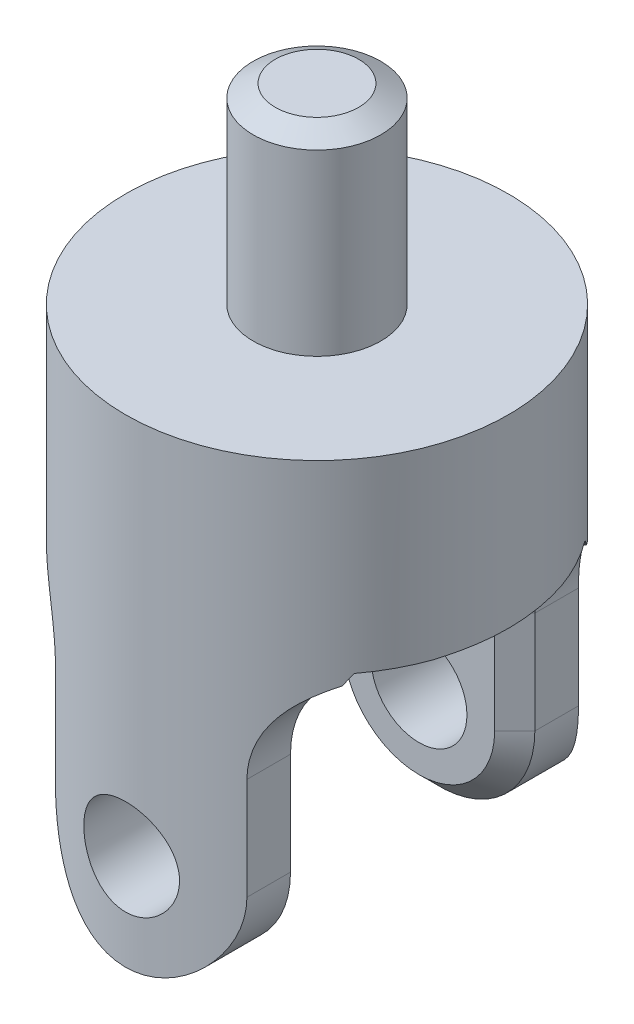
from build123d import *

# Parameters (mm, degrees)
SKETCH1_R               = 19.05
BASE_EXTRUDE_DEPTH      = 47.625
CUT_EXTRUDE1_DEPTH      = 55.716959208
CUT_EXTRUDE1_DEPTH_BACK = 55.716959208
CUT_EXTRUDE5_DEPTH      = 47.625
CUT_EXTRUDE5_DEPTH_BACK = 55.716959365
SKETCH8_W               = 20.32
SKETCH8_H               = 36.600526062
CUT_EXTRUDE6_DEPTH      = 55.716959365
CUT_EXTRUDE6_DEPTH_BACK = 55.716959365
SKETCH11_R              = 4.7625
SKETCH12_R              = 6.35
BOSS_EXTRUDE1_DEPTH     = 19.05
CHAMFER3_SIZE           = 1.27
CHAMFER3_SIZE2          = 2.199704526
CHAMFER4_SIZE           = 2


with BuildPart() as part:
    # Sketch1 → Base-Extrude (new body)
    with BuildSketch(Plane(origin=(0, 0, 0), x_dir=(-1, 0, 0), z_dir=(0, 1, 0))):
        with Locations(Location((0, 0, 0), (0, 0, 90))):
            Circle(SKETCH1_R)
    extrude(amount=BASE_EXTRUDE_DEPTH)

    # Sketch2 → Cut-Extrude1 (cut, two sides: drawn at the far end of the back side and taken through both)
    with BuildSketch(Plane.XY.offset(-CUT_EXTRUDE1_DEPTH_BACK)):
        with BuildLine():
            Line((9.525, 9.525), (9.525, 19.685))
            ThreePointArc((9.525, 19.685), (12.314807909, 26.420192091), (19.05, 29.21))
            Line((19.05, 29.21), (19.05, -1.366191125))
            Line((19.05, -1.366191125), (-19.05, -1.366191125))
            Line((-19.05, -1.366191125), (-19.05, 29.21))
            ThreePointArc((-19.05, 29.21), (-12.314807909, 26.420192091), (-9.525, 19.685))
            Line((-9.525, 19.685), (-9.525, 9.525))
            ThreePointArc((-9.525, 9.525), (0, 0), (9.525, 9.525))
        make_face()
    extrude(amount=CUT_EXTRUDE1_DEPTH + CUT_EXTRUDE1_DEPTH_BACK, mode=Mode.SUBTRACT)

    # Sketch8 → Cut-Extrude5 (cut, two sides: drawn at the far end of the back side and taken through both)
    with BuildSketch(Plane(origin=(0, 0, 0), x_dir=(0, 0, -1), z_dir=(1, 0, 0)).offset(-CUT_EXTRUDE5_DEPTH_BACK)):
        with Locations((0, 10.844975795)):
            Rectangle(SKETCH8_W, SKETCH8_H)
    extrude(amount=CUT_EXTRUDE5_DEPTH + CUT_EXTRUDE5_DEPTH_BACK, mode=Mode.SUBTRACT)

    # Sketch11 → Cut-Extrude6 (cut, two sides: drawn at the far end of the back side and taken through both)
    with BuildSketch(Plane.XY.offset(-CUT_EXTRUDE6_DEPTH_BACK)):
        with Locations(Location((0, 9.525, 0), (0, 0, 270))):
            Circle(SKETCH11_R)
    extrude(amount=CUT_EXTRUDE6_DEPTH + CUT_EXTRUDE6_DEPTH_BACK, mode=Mode.SUBTRACT)

    # Sketch12 → Boss-Extrude1 (add)
    with BuildSketch(Plane(origin=(0, 47.625, 0), x_dir=(-1, 0, 0), z_dir=(0, 1, 0))):
        with Locations(Location((0, 0, 0), (0, 0, 270))):
            Circle(SKETCH12_R)
    extrude(amount=BOSS_EXTRUDE1_DEPTH)

    # Chamfer3
    chamfer3_edges = [part.edges().sort_by_distance(p)[0] for p in [
        (0, 66.675, 6.35),
    ]]
    chamfer3_side = [part.faces().sort_by_distance(p)[0] for p in [
        (0, 57.15, 6.35),
    ]]
    chamfer(chamfer3_edges, length=CHAMFER3_SIZE, length2=CHAMFER3_SIZE2, reference=chamfer3_side[0])

    # Chamfer4
    # the kernel refuses this chamfer: 2 mm, written as the material it takes off along each edge
    with BuildSketch(Plane(origin=(-19.05, 19.685, -10.16), x_dir=(-0.22489517574669296, 0.974382963688233, 0), z_dir=(-0.974382963688233, -0.22489517574669296, 0))) as chamfer4_piece_1_section:
        Polygon((9.525 + CHAMFER4_SIZE, 0), (9.525, CHAMFER4_SIZE), (9.525, 0), align=None)
    chamfer4_piece_1 = revolve(axis=Axis((-19.05, 19.685, -10.16), (0, 0, -1)), revolution_arc=102.996714199, mode=Mode.PRIVATE)
    chamfer4_piece_1 = split(chamfer4_piece_1, bisect_by=Plane(origin=(-11.833499513, 29.145238826, -10.859553491), z_dir=(0, -1, 0)), keep=Keep.TOP, mode=Mode.PRIVATE)
    add(chamfer4_piece_1, mode=Mode.SUBTRACT)
    with BuildSketch(Plane(origin=(-9.525, 19.685, -10.16), x_dir=(0.9996219169112968, 0, 0.027495876610586487), z_dir=(0, -1, 0)), Plane(origin=(9.525, 9.525, -10.16), x_dir=(-0.9996219169112968, 0, 0.027495876610586487), z_dir=(0, 1, 0)), Plane(origin=(-9.525, 9.525, 10.16), x_dir=(0.9996219169112968, 0, -0.027495876610586487), z_dir=(0, 1, 0))) as chamfer4_piece_2:
        Polygon((CHAMFER4_SIZE * 0.999621916911, -CHAMFER4_SIZE * 0.0274958766106), (-CHAMFER4_SIZE * 0.0274958766106, -CHAMFER4_SIZE * 0.999621916911), (0, 0), align=None)
    extrude(amount=10.16, mode=Mode.SUBTRACT)
    with BuildSketch(Plane(origin=(0, 9.525, -10.16), x_dir=(1, 0, 0), z_dir=(0, 1, 0))) as chamfer4_piece_3:
        Polygon((9.525 - CHAMFER4_SIZE, 0), (9.525, CHAMFER4_SIZE), (9.525, 0), align=None)
    revolve(axis=Axis((0, 9.525, -10.16), (0, 0, -1)), revolution_arc=180, mode=Mode.SUBTRACT)
    with BuildSketch(Plane(origin=(19.05, 19.685, -10.16), x_dir=(-1, 0, 0), z_dir=(0, -1, 0))) as chamfer4_piece_4_section:
        Polygon((9.525 + CHAMFER4_SIZE, 0), (9.525, CHAMFER4_SIZE), (9.525, 0), align=None)
    chamfer4_piece_4 = revolve(axis=Axis((19.05, 19.685, -10.16), (0, 0, -1)), revolution_arc=102.99671421, mode=Mode.PRIVATE)
    chamfer4_piece_4 = split(chamfer4_piece_4, bisect_by=Plane(origin=(8.94755814, 29.145238826, -10.725370549), z_dir=(0, -1, 0)), keep=Keep.TOP, mode=Mode.PRIVATE)
    add(chamfer4_piece_4, mode=Mode.SUBTRACT)
    with BuildSketch(Plane(origin=(-19.05, 19.685, 10.16), x_dir=(-0.2248951759500051, 0.9743829636413067, 0), z_dir=(-0.9743829636413067, -0.2248951759500051, 0))) as chamfer4_piece_5_section:
        Polygon((9.525 + CHAMFER4_SIZE, 0), (9.525, -CHAMFER4_SIZE), (9.525, 0), align=None)
    chamfer4_piece_5 = revolve(axis=Axis((-19.05, 19.685, 10.16), (0, 0, -1)), revolution_arc=102.99671421, mode=Mode.PRIVATE)
    chamfer4_piece_5 = split(chamfer4_piece_5, bisect_by=Plane(origin=(-11.833499521, 29.145238826, 10.859553492), z_dir=(0, -1, 0)), keep=Keep.TOP, mode=Mode.PRIVATE)
    add(chamfer4_piece_5, mode=Mode.SUBTRACT)
    with BuildSketch(Plane(origin=(0, 9.525, 10.16), x_dir=(1, 0, 0), z_dir=(0, 1, 0))) as chamfer4_piece_6:
        Polygon((9.525, -CHAMFER4_SIZE), (9.525 - CHAMFER4_SIZE, 0), (9.525, 0), align=None)
    revolve(axis=Axis((0, 9.525, 10.16), (0, 0, -1)), revolution_arc=180, mode=Mode.SUBTRACT)
    with BuildSketch(Plane(origin=(9.525, 19.685, 10.16), x_dir=(0.027495876610586487, 0, 0.9996219169112968), z_dir=(0, -1, 0))) as chamfer4_piece_7:
        Polygon((CHAMFER4_SIZE * 0.999621916911, CHAMFER4_SIZE * 0.0274958766106), (-CHAMFER4_SIZE * 0.0274958766106, CHAMFER4_SIZE * 0.999621916911), (0, 0), align=None)
    extrude(amount=10.16, mode=Mode.SUBTRACT)
    with BuildSketch(Plane(origin=(19.05, 19.685, 10.16), x_dir=(-1, 0, 0), z_dir=(0, -1, 0))) as chamfer4_piece_8_section:
        Polygon((9.525, -CHAMFER4_SIZE), (9.525 + CHAMFER4_SIZE, 0), (9.525, 0), align=None)
    chamfer4_piece_8 = revolve(axis=Axis((19.05, 19.685, 10.16), (0, 0, -1)), revolution_arc=102.996714199, mode=Mode.PRIVATE)
    chamfer4_piece_8 = split(chamfer4_piece_8, bisect_by=Plane(origin=(11.833499509, 29.145238826, 10.859553501), z_dir=(0, -1, 0)), keep=Keep.TOP, mode=Mode.PRIVATE)
    add(chamfer4_piece_8, mode=Mode.SUBTRACT)


solid = part.part
